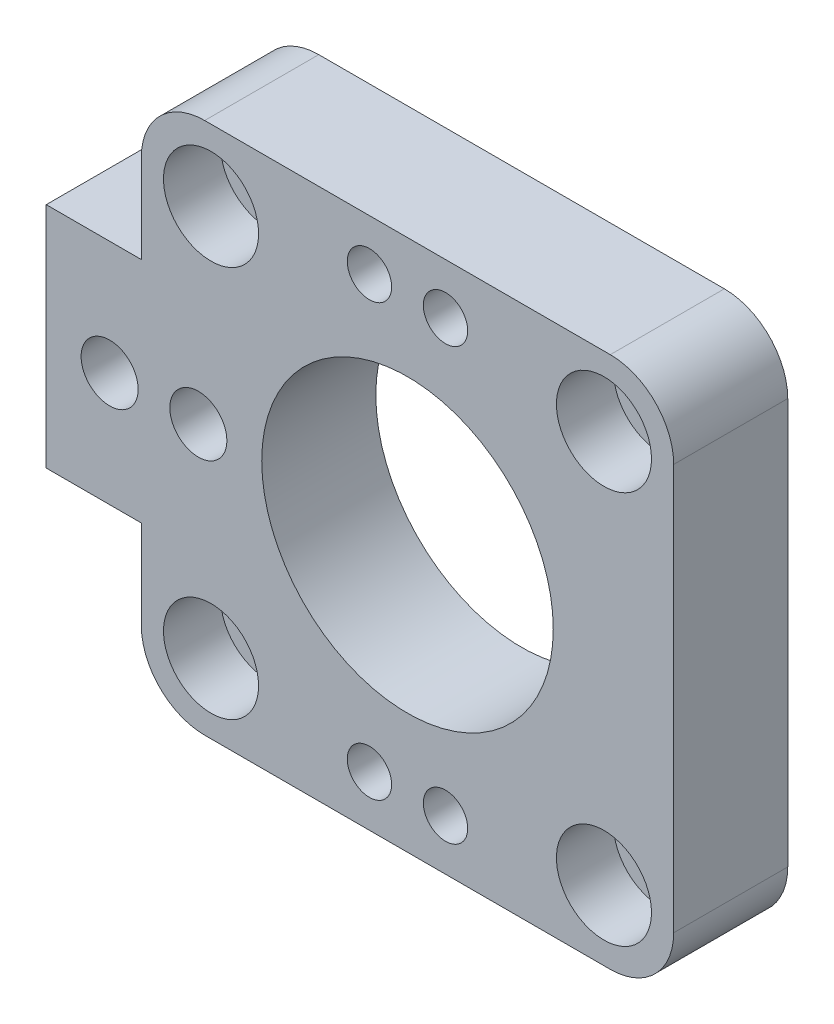
from build123d import *

# Parameters (mm, degrees)
ESQUISSE1_R             = 1.75
ESQUISSE1_R_2           = 11.5
BOSS_EXTRU_1_DEPTH      = 9
ESQUISSE9_R             = 2.25
ENL_V_MAT_EXTRU_2_DEPTH = 17
ENL_V_START             = -4.5
ESQUISSE10_R            = 2.25
ENL_V_MAT_EXTRU_3_DEPTH = 4.5
ESQUISSE11_R            = 3.75
ENL_V_MAT_EXTRU_4_DEPTH = 4.5
CONG_1_R                = 5
ESQUISSE12_R            = 1.75
ENL_V_MAT_EXTRU_5_DEPTH = 10
ESQUISSE14_R            = 1.75
ENL_V_MAT_EXTRU_8_DEPTH = 4.5


with BuildPart() as part:
    # Esquisse1 → Boss.-Extru.1 (new body)
    with BuildSketch(Plane.XY):
        Polygon((0, -42), (0, 0), (-42, 0), (-42, -12), (-49.5, -12), (-49.5, -30), (-42, -30), (-42, -42), align=None)
        with Locations((-36.5, -36.5)):
            Circle(ESQUISSE1_R, mode=Mode.SUBTRACT)
        with Locations((-5.5, -36.5)):
            Circle(ESQUISSE1_R, mode=Mode.SUBTRACT)
        with Locations((-36.5, -5.611040912)):
            Circle(ESQUISSE1_R, mode=Mode.SUBTRACT)
        with Locations((-21, -21)):
            Circle(ESQUISSE1_R_2, mode=Mode.SUBTRACT)
        with Locations((-5.5, -5.5)):
            Circle(ESQUISSE1_R, mode=Mode.SUBTRACT)
    extrude(amount=BOSS_EXTRU_1_DEPTH)

    # Esquisse9 → Enlèv. mat.-Extru.2 (cut)
    with BuildSketch(Plane.XY.offset(9)):
        with Locations((-44.5, -21)):
            Circle(ESQUISSE9_R)
        with Locations((-37.5, -21)):
            Circle(ESQUISSE9_R)
    extrude(amount=-ENL_V_MAT_EXTRU_2_DEPTH, mode=Mode.SUBTRACT)

    # Esquisse10 → Enlèv. mat.-Extru.3 (cut)
    with BuildSketch(Plane(origin=(0, 0, 0), x_dir=(-1, 0, 0), z_dir=(0, 0, -1)).offset(ENL_V_START)):
        Polygon((41, -23.309401077), (44.5, -25.330127019), (48.25, -23.165063509), (48.25, -18.834936491), (44.5, -16.669872981), (41, -18.690598923), (37.5, -16.669872981), (33.75, -18.834936491), (33.75, -23.165063509), (37.5, -25.330127019), align=None)
        with Locations((44.5, -21)):
            Circle(ESQUISSE10_R, mode=Mode.SUBTRACT)
    extrude(amount=ENL_V_MAT_EXTRU_3_DEPTH, mode=Mode.SUBTRACT)

    # Esquisse11 → Enlèv. mat.-Extru.4 (cut)
    with BuildSketch(Plane.XY.offset(9)):
        with Locations((-36.5, -5.611040912)):
            Circle(ESQUISSE11_R)
        with Locations((-5.5, -5.5)):
            Circle(ESQUISSE11_R)
        with Locations((-5.5, -36.5)):
            Circle(ESQUISSE11_R)
        with Locations((-36.5, -36.5)):
            Circle(ESQUISSE11_R)
    extrude(amount=-ENL_V_MAT_EXTRU_4_DEPTH, mode=Mode.SUBTRACT)

    # Congé1
    cong_1_edges = [part.edges().sort_by_distance(p)[0] for p in [
        (-42, 0, 4.5),
        (0, 0, 4.5),
        (0, -42, 4.5),
        (-42, -42, 4.5),
    ]]
    fillet(cong_1_edges, radius=CONG_1_R)

    # Esquisse12 → Enlèv. mat.-Extru.5 (cut)
    with BuildSketch(Plane.XY.offset(9)):
        with Locations((-24, -38)):
            Circle(ESQUISSE12_R)
        with Locations((-18, -38)):
            Circle(ESQUISSE12_R)
        with Locations((-24, -4)):
            Circle(ESQUISSE12_R)
        with Locations((-18, -4)):
            Circle(ESQUISSE12_R)
    extrude(amount=-ENL_V_MAT_EXTRU_5_DEPTH, mode=Mode.SUBTRACT)

    # Esquisse14 → Enlèv. mat.-Extru.8 (cut)
    # profile 1 of 2: a face of its own
    with BuildSketch(Plane(origin=(0, 0, 0), x_dir=(-1, 0, 0), z_dir=(0, 0, -1)).offset(ENL_V_START)):
        Polygon((24, -41.464101615), (27, -39.732050808), (27, -36.267949192), (24, -34.535898385), (21, -36.267949192), (18, -34.535898385), (15, -36.267949192), (15, -39.732050808), (18, -41.464101615), (21, -39.732050808), align=None)
        with Locations((24, -38)):
            Circle(ESQUISSE14_R, mode=Mode.SUBTRACT)
        with Locations((18, -38)):
            Circle(ESQUISSE14_R, mode=Mode.SUBTRACT)
    # profile 2 of 2: a face of its own
    with BuildSketch(Plane(origin=(0, 0, 0), x_dir=(-1, 0, 0), z_dir=(0, 0, -1)).offset(ENL_V_START)):
        Polygon((24, -7.464101615), (27, -5.732050808), (27, -2.267949192), (24, -0.535898385), (21, -2.267949192), (18, -0.535898385), (15, -2.267949192), (15, -5.732050808), (18, -7.464101615), (21, -5.732050808), align=None)
        with Locations((24, -4)):
            Circle(ESQUISSE14_R, mode=Mode.SUBTRACT)
        with Locations((18, -4)):
            Circle(ESQUISSE14_R, mode=Mode.SUBTRACT)
    extrude(amount=ENL_V_MAT_EXTRU_8_DEPTH, mode=Mode.SUBTRACT)


solid = part.part
